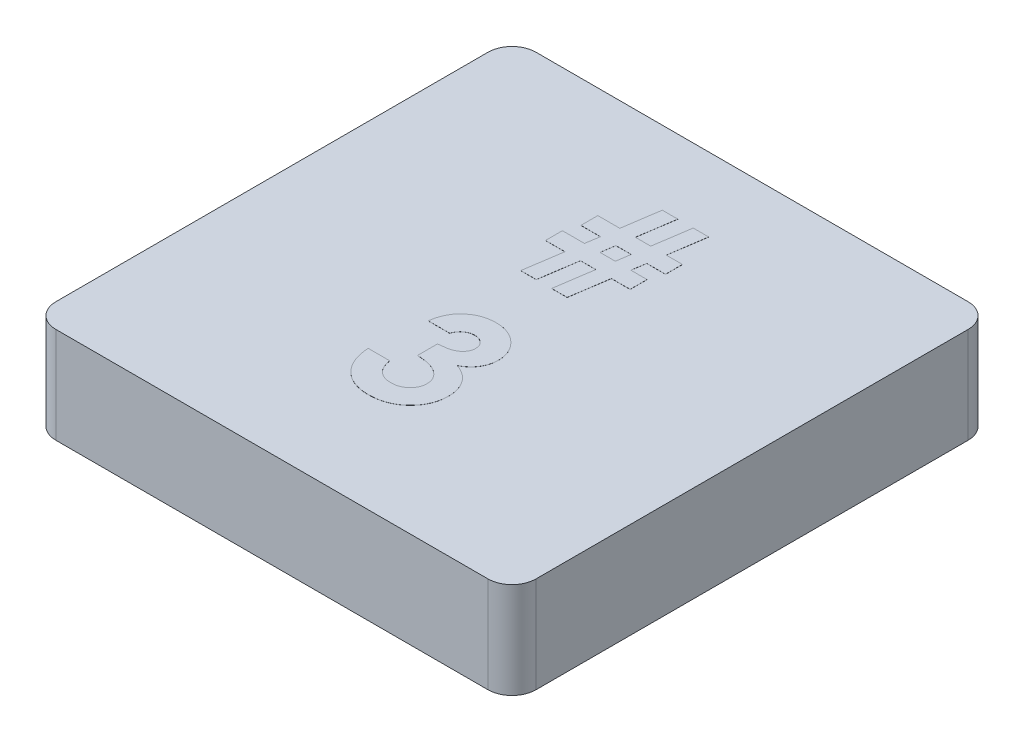
from build123d import *

# Parameters (mm, degrees)
SKETCH1_W           = 12.7
SKETCH1_H           = 12.7
BOSS_EXTRUDE1_DEPTH = 2.54
FILLET1_R           = 0.635
SHELL1_START        = 0.635
SHELL1_OUTLINE_W    = 1.905
SHELL1_OUTLINE_H    = 11.43
SHELL1_DEPTH        = 11.43
SKETCH2_R           = 2.54
BOSS_EXTRUDE2_DEPTH = 1.905
BOSS_EXTRUDE4_DEPTH = 0.00254


# Read off the part's stored shape, not the designer's step: Shell1
with BuildPart() as part:
    # Sketch1 → Boss-Extrude1 (new body)
    with BuildSketch(Plane(origin=(0, 0, 0), x_dir=(1, 0, 0), z_dir=(0, 1, 0))):
        with Locations((6.35, 6.35)):
            Rectangle(SKETCH1_W, SKETCH1_H)
    extrude(amount=BOSS_EXTRUDE1_DEPTH)

    # Fillet1
    fillet1_edges = [part.edges().sort_by_distance(p)[0] for p in [
        (0, 1.27, -12.7),
        (12.7, 1.27, -12.7),
        (12.7, 1.27, 0),
        (0, 1.27, 0),
    ]]
    fillet(fillet1_edges, radius=FILLET1_R)

    # Shell1 outline → Shell1 (cut)
    with BuildSketch(Plane.YZ.offset(SHELL1_START)):
        with Locations((0.9525, -6.35)):
            Rectangle(SHELL1_OUTLINE_W, SHELL1_OUTLINE_H)
    extrude(amount=SHELL1_DEPTH, mode=Mode.SUBTRACT)

    # Sketch2 → Boss-Extrude2 (add)
    with BuildSketch(Plane(origin=(0, 1.905, 0), x_dir=(-1, 0, 0), z_dir=(0, -1, 0))):
        with Locations(Location((-6.35, 6.35, 0), (0, 0, 270))):
            Circle(SKETCH2_R)
    extrude(amount=BOSS_EXTRUDE2_DEPTH)

    # Sketch4 → Boss-Extrude4 (add)
    # profile 1 of 2: a face of its own
    with BuildSketch(Plane(origin=(0, 2.54, 0), x_dir=(1, 0, 0), z_dir=(0, 1, 0))):
        with BuildLine():
            Line((5.934807692, 5.119402564), (5.364935897, 5.119402564))
            add(Edge.make_bspline(
                [(5.364935897, 5.119402564), (5.368959409, 5.147888422), (5.376847237, 5.20373306), (5.395721754, 5.284582184), (5.418297714, 5.361273111), (5.446482646, 5.433562976), (5.479538986, 5.501580553), (5.517130588, 5.565559244), (5.559663832, 5.62522444), (5.592266013, 5.661166991), (5.608530649, 5.679098077)],
                knots=[0, 0, 0, 0, 1.111473889, 2.178970933, 3.205615836, 4.199322666, 5.174200091, 6.12565194, 7.064921805, 8, 8, 8, 8], degree=3))
            add(Edge.make_bspline(
                [(5.608530649, 5.679098077), (5.631990231, 5.702756845), (5.678226603, 5.749385791), (5.755493002, 5.80911232), (5.836482457, 5.86080157), (5.922819249, 5.90178118), (6.01315991, 5.934949428), (6.108222861, 5.957228614), (6.207619641, 5.972011051), (6.275445439, 5.973467173), (6.310058093, 5.974210256)],
                knots=[0, 0, 0, 0, 1.01925491, 2.00884431, 2.983262333, 3.955970413, 4.92937149, 5.924503185, 6.940838805, 8, 8, 8, 8], degree=3))
            add(Edge.make_bspline(
                [(6.310058093, 5.974210256), (6.340830523, 5.97348378), (6.401322921, 5.972055673), (6.490231524, 5.960591605), (6.574998436, 5.940484907), (6.656519669, 5.91419585), (6.733596311, 5.878425195), (6.807929518, 5.836903078), (6.877442417, 5.785974475), (6.942297657, 5.72843028), (7.001879563, 5.6661906), (7.053477755, 5.5996615), (7.097837647, 5.530620126), (7.13438433, 5.458492875), (7.162483763, 5.3831577), (7.181985603, 5.3050498), (7.194750031, 5.224341527), (7.196021701, 5.169485202), (7.196666667, 5.141663181)],
                knots=[0, 0, 0, 0, 1.091422571, 2.145516843, 3.172569842, 4.178562979, 5.178154469, 6.181868002, 7.194278174, 8.227918432, 9.254613415, 10.245994977, 11.209837596, 12.161663635, 13.10878368, 14.055455738, 15.013766427, 16, 16, 16, 16], degree=3))
            add(Edge.make_bspline(
                [(7.196666667, 5.141663181), (7.195343159, 5.107207926), (7.192737578, 5.039376121), (7.171356906, 4.940099234), (7.137890339, 4.845172814), (7.089544629, 4.755925024), (7.029100177, 4.672598746), (6.954936859, 4.597979827), (6.869167039, 4.530898345), (6.804778493, 4.494848748), (6.771806891, 4.476388742)],
                knots=[0, 0, 0, 0, 0.992805628, 1.954529043, 2.915727527, 3.886831945, 4.871318353, 5.87440735, 6.911542536, 8, 8, 8, 8], degree=3))
            add(Edge.make_bspline(
                [(6.771806891, 4.476388742), (6.794438093, 4.468958442), (6.838907389, 4.454358236), (6.902115146, 4.425603295), (6.9622185, 4.394178911), (7.018182494, 4.35767206), (7.070563757, 4.317558919), (7.119042965, 4.273496584), (7.163909772, 4.225581133), (7.204431745, 4.173549048), (7.24039658, 4.118232482), (7.27266591, 4.060909215), (7.299225368, 4.000709929), (7.321724536, 3.93832214), (7.338854121, 3.87318514), (7.350914879, 3.805551328), (7.357886294, 3.735574984), (7.358949554, 3.688166053), (7.359487179, 3.664194231)],
                knots=[0, 0, 0, 0, 1.059543567, 2.081955587, 3.086750234, 4.076226789, 5.052108497, 6.020845489, 6.989030705, 7.970690546, 8.952259656, 9.923888338, 10.895517021, 11.877585046, 12.873342345, 13.889638361, 14.932918083, 16, 16, 16, 16], degree=3))
            add(Edge.make_bspline(
                [(7.359487179, 3.664194231), (7.35839734, 3.628965386), (7.356248397, 3.559501278), (7.342586427, 3.457187755), (7.3171503, 3.359640902), (7.283687665, 3.265738294), (7.239052143, 3.176692179), (7.186523637, 3.090459071), (7.12195555, 3.010029511), (7.050199207, 2.933277148), (6.970509605, 2.863497337), (6.884113113, 2.803001381), (6.792909514, 2.751085086), (6.69632179, 2.70893796), (6.594383498, 2.676479852), (6.487321848, 2.653017635), (6.374686998, 2.638663063), (6.297804901, 2.637158258), (6.258540665, 2.636389744)],
                knots=[0, 0, 0, 0, 1.005138573, 1.981928558, 2.936866704, 3.876260664, 4.820238198, 5.773547, 6.751179199, 7.756627054, 8.768222608, 9.766606018, 10.760583154, 11.757261445, 12.767156078, 13.807575856, 14.880313354, 16, 16, 16, 16], degree=3))
            add(Edge.make_bspline(
                [(6.258540665, 2.636389744), (6.221397331, 2.637200012), (6.148768458, 2.638784385), (6.042533529, 2.652497937), (5.941567286, 2.674619009), (5.845612059, 2.705800494), (5.755039093, 2.746237552), (5.669027037, 2.794389014), (5.589292242, 2.853032146), (5.514946305, 2.919519685), (5.447638443, 2.994114929), (5.387481066, 3.075089915), (5.335800653, 3.162752559), (5.292385263, 3.25672833), (5.257574306, 3.357182088), (5.230115525, 3.463909556), (5.210935117, 3.577119247), (5.205093684, 3.655009923), (5.202115385, 3.694723077)],
                knots=[0, 0, 0, 0, 1.066544725, 2.085487077, 3.070979577, 4.031932826, 4.977951092, 5.916076795, 6.857635327, 7.814973522, 8.776389752, 9.738577119, 10.707772778, 11.69409279, 12.707140348, 13.757286496, 14.856535458, 16, 16, 16, 16], degree=3))
            Line((5.202115385, 3.694723077), (5.771987179, 3.694723077))
            add(Edge.make_bspline(
                [(5.771987179, 3.694723077), (5.775598398, 3.674754782), (5.782632192, 3.635861291), (5.796351176, 3.579552162), (5.814228927, 3.527575358), (5.834900055, 3.479468911), (5.857227985, 3.434601199), (5.884205464, 3.394629299), (5.913855724, 3.358467809), (5.956641266, 3.315478631), (6.017806144, 3.271309046), (6.100398993, 3.232923574), (6.192275716, 3.210424972), (6.256506709, 3.207680212), (6.289705529, 3.206261538)],
                knots=[0, 0, 0, 0, 0.928156231, 1.807827665, 2.648129825, 3.438902246, 4.202261636, 4.936546065, 5.639352463, 6.338805438, 7.70633318, 9.064371875, 10.482673459, 12, 12, 12, 12], degree=3))
            add(Edge.make_bspline(
                [(6.289705529, 3.206261538), (6.307321996, 3.206563632), (6.341828715, 3.207155365), (6.392513946, 3.213713931), (6.440798765, 3.224515896), (6.486773106, 3.239195366), (6.530729643, 3.257596999), (6.571828542, 3.281324803), (6.610907503, 3.308911763), (6.647541702, 3.33992683), (6.681392456, 3.37372215), (6.709558274, 3.411144725), (6.735299794, 3.449172751), (6.754338407, 3.490294153), (6.771020334, 3.532296162), (6.781230526, 3.576703319), (6.788939954, 3.622584081), (6.789387995, 3.65398286), (6.789615385, 3.669918389)],
                knots=[0, 0, 0, 0, 1.110435564, 2.175094844, 3.216326037, 4.226890168, 5.215276772, 6.21526065, 7.213097102, 8.228249917, 9.239874822, 10.221364777, 11.178138315, 12.128914389, 13.072518965, 14.022636769, 14.996447288, 16, 16, 16, 16], degree=3))
            add(Edge.make_bspline(
                [(6.789615385, 3.669918389), (6.789011707, 3.687346606), (6.787809922, 3.722042192), (6.777991215, 3.772673103), (6.762485401, 3.82137596), (6.740945932, 3.867935082), (6.712182371, 3.912178862), (6.678241691, 3.954994964), (6.636449926, 3.994154886), (6.590598763, 4.032863282), (6.537429426, 4.06660533), (6.479531337, 4.097744282), (6.415382845, 4.122521274), (6.34654987, 4.144651717), (6.271730374, 4.16081545), (6.191388958, 4.172551894), (6.105655223, 4.181287859), (6.046557845, 4.182541177), (6.016217949, 4.183184615)],
                knots=[0, 0, 0, 0, 0.809814727, 1.612155564, 2.388397, 3.182215007, 3.988903953, 4.837162975, 5.715530372, 6.646997145, 7.623086902, 8.637258368, 9.698941581, 10.815059213, 11.996518529, 13.252603015, 14.589518788, 16, 16, 16, 16], degree=3))
            Line((6.016217949, 4.183184615), (6.016217949, 4.712351282))
            add(Edge.make_bspline(
                [(6.016217949, 4.712351282), (6.053992924, 4.71556832), (6.124662423, 4.72158676), (6.222755477, 4.735661093), (6.305337183, 4.754473756), (6.374392395, 4.777170215), (6.431731419, 4.806318382), (6.481822473, 4.838496672), (6.524963258, 4.875867052), (6.561423009, 4.917315143), (6.590589675, 4.961826507), (6.611232142, 5.008709304), (6.624863349, 5.056512924), (6.626154905, 5.089209158), (6.626794872, 5.105410176)],
                knots=[0, 0, 0, 0, 1.70044513, 3.18119609, 4.440695891, 5.496282586, 6.431922213, 7.318171381, 8.16090191, 8.983045123, 9.787564368, 10.536848927, 11.275007137, 12, 12, 12, 12], degree=3))
            add(Edge.make_bspline(
                [(6.626794872, 5.105410176), (6.625690745, 5.126080916), (6.623535724, 5.166425824), (6.606798659, 5.224167886), (6.577745012, 5.275640149), (6.538789172, 5.3207343), (6.491320127, 5.358400315), (6.435678085, 5.385745199), (6.373070481, 5.40181154), (6.329022659, 5.403477078), (6.306241987, 5.404338462)],
                knots=[0, 0, 0, 0, 1.009664648, 1.970651636, 2.907870547, 3.878035693, 4.867062054, 5.849714035, 6.887914197, 8, 8, 8, 8], degree=3))
            add(Edge.make_bspline(
                [(6.306241987, 5.404338462), (6.28559387, 5.403322119), (6.244621681, 5.401305385), (6.184708077, 5.386253015), (6.127810114, 5.360914223), (6.075105989, 5.325973522), (6.027356496, 5.284011222), (5.988167939, 5.234315587), (5.955572755, 5.179863969), (5.941756515, 5.139635374), (5.934807692, 5.119402564)],
                knots=[0, 0, 0, 0, 0.98818071, 1.960853194, 2.938124878, 3.957524365, 4.978590984, 5.968022688, 6.978025184, 8, 8, 8, 8], degree=3))
        make_face()
    # profile 2 of 2: a face of its own
    with BuildSketch(Plane(origin=(0, 2.54, 0), x_dir=(1, 0, 0), z_dir=(0, 1, 0))):
        Polygon((7.313897436, 8.958384615), (7.313897436, 8.510628205), (6.819075721, 8.510628205), (6.66643149, 7.493), (6.255564103, 7.493), (6.408208333, 8.510628205), (6.001157051, 8.510628205), (5.848512821, 7.493), (5.437645433, 7.493), (5.590289663, 8.510628205), (5.075115385, 8.510628205), (5.075115385, 8.958384615), (5.657707532, 8.958384615), (5.716221154, 9.324730769), (5.197230769, 9.324730769), (5.197230769, 9.772487179), (5.779822917, 9.772487179), (5.926106971, 10.749410256), (6.336974359, 10.749410256), (6.190054287, 9.772487179), (6.597741587, 9.772487179), (6.744025641, 10.749410256), (7.154257011, 10.749410256), (7.007972957, 9.772487179), (7.436012821, 9.772487179), (7.436012821, 9.324730769), (6.940555088, 9.324730769), (6.883949519, 8.958384615), align=None)
        Polygon((6.530323718, 9.324730769), (6.123272436, 9.324730769), (6.06857492, 8.958384615), (6.475626202, 8.958384615), align=None, mode=Mode.SUBTRACT)
    extrude(amount=BOSS_EXTRUDE4_DEPTH)


solid = part.part
